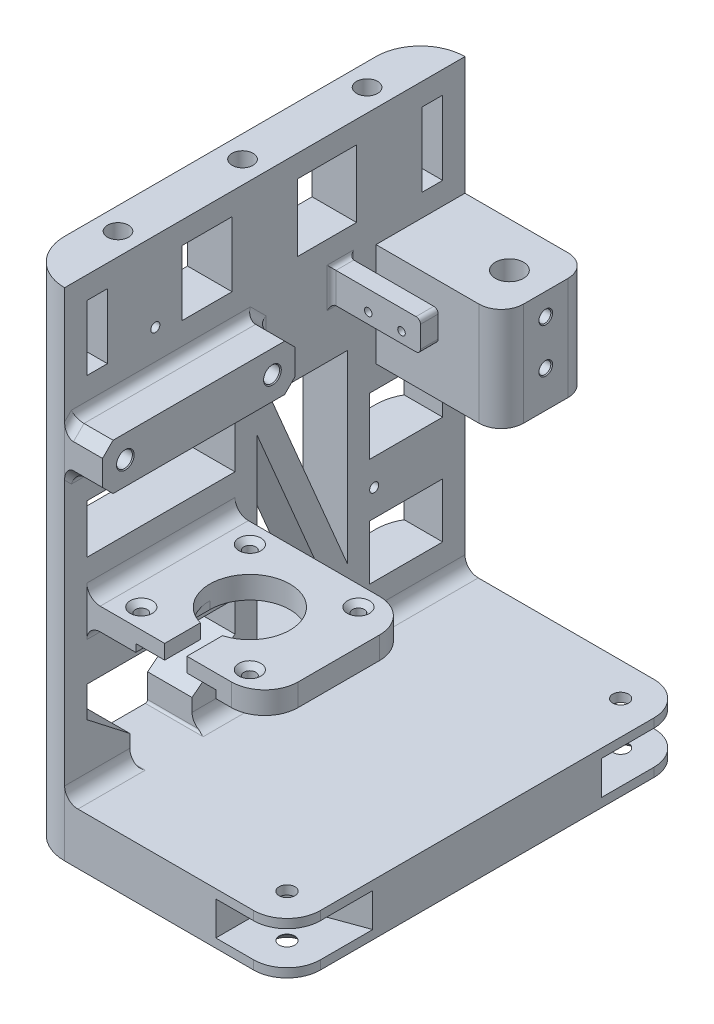
from build123d import *

# Parameters (mm, degrees)
BOSS_EXTRUDE1_DEPTH                             = 7.366
CUT_EXTRUDE1_DEPTH                              = 4.826
CSK_FOR_M4_FLAT_HEAD_MACHINE_SCREW1_D           = 4.5
CSK_FOR_M4_FLAT_HEAD_MACHINE_SCREW1_CSINK_D     = 9.4
CSK_FOR_M4_FLAT_HEAD_MACHINE_SCREW1_CSINK_ANGLE = 90
BOSS_EXTRUDE4_START                             = 127
BOSS_EXTRUDE4_DEPTH                             = 127
SKETCH31_R                                      = 3
CUT_EXTRUDE11_DEPTH                             = 25.4
FILLET3_R                                       = 3.81
SKETCH5_R                                       = 2.275
BOSS_EXTRUDE5_DEPTH                             = 10.840000164
CHAMFER1_SIZE                                   = 0.254
FILLET4_R                                       = 2.54
SKETCH9_W                                       = 42.3
SKETCH9_H                                       = 6.35
BOSS_EXTRUDE6_DEPTH                             = 50.8
CUT_EXTRUDE6_DEPTH                              = 106.448246074
CUT_EXTRUDE6_DEPTH_BACK                         = 6.35
CSK_FOR_M3_FLAT_HEAD_MACHINE_SCREW1_D           = 3.4
CSK_FOR_M3_FLAT_HEAD_MACHINE_SCREW1_DEPTH       = 6.35
CSK_FOR_M3_FLAT_HEAD_MACHINE_SCREW1_CSINK_D     = 6.3
CSK_FOR_M3_FLAT_HEAD_MACHINE_SCREW1_CSINK_ANGLE = 90
SKETCH13_W                                      = 22.86
SKETCH13_H                                      = 2.2
CUT_EXTRUDE7_DEPTH                              = 21.15
FILLET1_R                                       = 9.525
FILLET2_R                                       = 3.81
CUT_EXTRUDE8_DEPTH                              = 160.224980628
CUT_EXTRUDE8_DEPTH_BACK                         = 160.224980628
SKETCH20_W                                      = 25.4
SKETCH20_H                                      = 29.476999974
BOSS_EXTRUDE10_DEPTH                            = 35.76955
SKETCH21_R                                      = 4.01955
CUT_EXTRUDE9_DEPTH                              = 26.301999974
F_3_4_3_4_DIAMETER_HOLE4_D                      = 3.4
F_3_4_3_4_DIAMETER_HOLE4_DEPTH                  = 10.36955
F_3_4_3_4_DIAMETER_HOLE4_TIP                    = 1.021463052
CHAMFER2_SIZE                                   = 0.254
FILLET8_R                                       = 6.35
SKETCH26_W                                      = 5.08
SKETCH26_H                                      = 8.730000066
BOSS_EXTRUDE11_DEPTH                            = 25.4
SKETCH28_R                                      = 1.075
CUT_EXTRUDE10_DEPTH                             = 5.08
FILLET9_R                                       = 1.27
SKETCH34_R                                      = 1.3
CUT_EXTRUDE13_DEPTH                             = 12.7
CHAMFER3_SIZE                                   = 0.1905
SKETCH38_W                                      = 5.89
SKETCH38_H                                      = 21.09
SKETCH38_W_2                                    = 16.86
SKETCH38_H_2                                    = 19.202266412
SKETCH38_W_3                                    = 14.272
SKETCH38_H_3                                    = 18.55
SKETCH38_W_4                                    = 42.3
SKETCH38_H_4                                    = 13.97
SKETCH38_W_5                                    = 20.828
SKETCH38_H_5                                    = 16.362000012
SKETCH38_H_6                                    = 15.621000014
CUT_EXTRUDE14_DEPTH                             = 160.224980664


with BuildPart() as part:
    # Sketch1 → Boss-Extrude1 (new, symmetric)
    with BuildSketch(Plane(origin=(0, 0, 0), x_dir=(1, 0, 0), z_dir=(0, 1, 0))):
        with BuildLine():
            Line((-25.4, 57.15), (28.575, 57.15))
            ThreePointArc((28.575, 57.15), (35.310192091, 54.360192091), (38.1, 47.625))
            Line((38.1, 47.625), (38.1, -47.625))
            ThreePointArc((38.1, -47.625), (35.310192091, -54.360192091), (28.575, -57.15))
            Line((28.575, -57.15), (-25.4, -57.15))
            ThreePointArc((-25.4, -57.15), (-34.380256121, -53.430256121), (-38.1, -44.45))
            Line((-38.1, -44.45), (-38.1, 44.45))
            ThreePointArc((-38.1, 44.45), (-34.380256121, 53.430256121), (-25.4, 57.15))
        make_face()
    extrude(amount=BOSS_EXTRUDE1_DEPTH, both=True)

    # Sketch1<5> → Cut-Extrude1 (cut, symmetric)
    with BuildSketch(Plane(origin=(0, 0, 0), x_dir=(1, 0, 0), z_dir=(0, 1, 0))):
        with BuildLine():
            ThreePointArc((24.882892553, -37.481018159), (19.732253682, -41.43324237), (17.78, -47.625))
            Line((17.78, -47.625), (17.78, -57.15))
            Line((17.78, -57.15), (28.575, -57.15))
            ThreePointArc((28.575, -57.15), (35.310192091, -54.360192091), (38.1, -47.625))
            Line((38.1, -47.625), (38.1, -32.670384465))
            Line((38.1, -32.670384465), (24.882892553, -37.481018159))
        make_face()
        with BuildLine():
            Line((24.882892553, 37.481018159), (38.1, 32.670384465))
            Line((38.1, 32.670384465), (38.1, 47.625))
            ThreePointArc((38.1, 47.625), (35.310192091, 54.360192091), (28.575, 57.15))
            Line((28.575, 57.15), (17.78, 57.15))
            Line((17.78, 57.15), (17.78, 47.625))
            ThreePointArc((17.78, 47.625), (19.732253682, 41.43324237), (24.882892553, 37.481018159))
        make_face()
    extrude(amount=CUT_EXTRUDE1_DEPTH, both=True, mode=Mode.SUBTRACT)

    # CSK for M4 Flat Head Machine Screw1 (through all)
    with Locations(Plane.XZ.offset(7.366)):
        with Locations((28.575, 47.625), (28.575, -47.625)):
            CounterSinkHole(CSK_FOR_M4_FLAT_HEAD_MACHINE_SCREW1_D / 2, CSK_FOR_M4_FLAT_HEAD_MACHINE_SCREW1_CSINK_D / 2, counter_sink_angle=CSK_FOR_M4_FLAT_HEAD_MACHINE_SCREW1_CSINK_ANGLE)

    # Sketch4 → Boss-Extrude4 (add)
    with BuildSketch(Plane(origin=(0, 7.366, 0), x_dir=(1, 0, 0), z_dir=(0, 1, 0)).offset(BOSS_EXTRUDE4_START)):
        with BuildLine():
            Line((-38.1, 44.45), (-38.1, -44.45))
            ThreePointArc((-38.1, -44.45), (-34.380256121, -53.430256121), (-25.4, -57.15))
            Line((-25.4, -57.15), (-25.4, 57.15))
            ThreePointArc((-25.4, 57.15), (-34.380256121, 53.430256121), (-38.1, 44.45))
        make_face()
    extrude(amount=-BOSS_EXTRUDE4_DEPTH)

    # Sketch31 → Cut-Extrude11 (cut)
    with BuildSketch(Plane(origin=(0, 134.366, 0), x_dir=(1, 0, 0), z_dir=(0, 1, 0))):
        with Locations(Location((-31.75, 0, 0), (0, 0, 270))):
            Circle(SKETCH31_R)
        with Locations(Location((-31.75, 35.56, 0), (0, 0, 270))):
            Circle(SKETCH31_R)
        with Locations(Location((-31.75, -35.56, 0), (0, 0, 270))):
            Circle(SKETCH31_R)
    extrude(amount=-CUT_EXTRUDE11_DEPTH, mode=Mode.SUBTRACT)

    # Fillet3
    # the kernel refuses this fillet: 3.81 mm, written as the material it adds along each edge
    with BuildSketch(Plane(origin=(-25.4, 7.366, 57.15), x_dir=(1, 0, 0), z_dir=(0, 0, -1))) as fillet3_piece_1:
        with BuildLine():
            CenterArc((FILLET3_R, -FILLET3_R), FILLET3_R, 90, 90)
            Line((0, -FILLET3_R), (0, 0))
            Line((0, 0), (FILLET3_R, 0))
        make_face()
    extrude(amount=114.3)

    # Sketch5 → Boss-Extrude5 (add)
    with BuildSketch(Plane(origin=(-25.4, 0, 0), x_dir=(0, 0, -1), z_dir=(1, 0, 0))):
        Polygon((-5.15, 100.576), (-54.15, 100.576), (-57.15, 97.576), (-57.15, 90.376), (-54.15, 87.376), (-5.15, 87.376), (-2.15, 90.376), (-2.15, 97.576), align=None)
        with Locations((-8.65, 93.976)):
            Circle(SKETCH5_R, mode=Mode.SUBTRACT)
        with Locations((-50.65, 93.976)):
            Circle(SKETCH5_R, mode=Mode.SUBTRACT)
    extrude(amount=BOSS_EXTRUDE5_DEPTH)

    # Chamfer1
    chamfer1_edges = [part.edges().sort_by_distance(p)[0] for p in [
        (-14.559999836, 93.976, 10.925),
        (-14.559999836, 93.976, 52.925),
    ]]
    chamfer(chamfer1_edges, length=CHAMFER1_SIZE)

    # Fillet4
    fillet4_edges = [part.edges().sort_by_distance(p)[0] for p in [
        (-25.4, 99.076, 3.65),
        (-25.4, 100.576, 29.65),
        (-25.4, 99.076, 55.65),
        (-25.4, 88.876, 55.65),
        (-25.4, 87.376, 29.65),
        (-25.4, 88.876, 3.65),
        (-25.4, 93.976, 2.15),
    ]]
    fillet(fillet4_edges, radius=FILLET4_R)

    # Sketch9 → Boss-Extrude6 (add)
    with BuildSketch(Plane(origin=(-25.4, 0, 0), x_dir=(0, 0, -1), z_dir=(1, 0, 0))):
        with Locations((-29.65, 51.181)):
            Rectangle(SKETCH9_W, SKETCH9_H)
    extrude(amount=BOSS_EXTRUDE6_DEPTH)

    # Sketch12 → Cut-Extrude6 (cut, two sides: drawn at the far end of the back side and taken through both)
    with BuildSketch(Plane(origin=(0, 54.356, 0), x_dir=(1, 0, 0), z_dir=(0, 1, 0)).offset(-CUT_EXTRUDE6_DEPTH_BACK)):
        with BuildLine():
            Line((-3.175, -40.630176456), (-3.175, -50.8))
            Line((-3.175, -50.8), (3.175, -50.8))
            Line((3.175, -50.8), (3.175, -40.630176456))
            ThreePointArc((3.175, -40.630176456), (0, -18.22), (-3.175, -40.630176456))
        make_face()
    extrude(amount=CUT_EXTRUDE6_DEPTH + CUT_EXTRUDE6_DEPTH_BACK, mode=Mode.SUBTRACT)

    # CSK for M3 Flat Head Machine Screw1
    with Locations(Plane(origin=(0, 54.356, 0), x_dir=(1, 0, 0), z_dir=(0, 1, 0))):
        with Locations((15.5, -14.15), (-15.5, -45.15), (-15.5, -14.15), (15.5, -45.15)):
            CounterSinkHole(CSK_FOR_M3_FLAT_HEAD_MACHINE_SCREW1_D / 2, CSK_FOR_M3_FLAT_HEAD_MACHINE_SCREW1_CSINK_D / 2, depth=CSK_FOR_M3_FLAT_HEAD_MACHINE_SCREW1_DEPTH, counter_sink_angle=CSK_FOR_M3_FLAT_HEAD_MACHINE_SCREW1_CSINK_ANGLE)

    # Sketch13 → Cut-Extrude7 (cut)
    with BuildSketch(Plane(origin=(-25.4, 0, 50.8), x_dir=(-1, 0, 0), z_dir=(0, 0, -1))):
        with Locations((-25.4, 49.106)):
            Rectangle(SKETCH13_W, SKETCH13_H)
    extrude(amount=CUT_EXTRUDE7_DEPTH, mode=Mode.SUBTRACT)

    # Fillet1
    fillet1_edges = [part.edges().sort_by_distance(p)[0] for p in [
        (25.4, 51.181, 50.8),
        (25.4, 51.181, 8.5),
    ]]
    fillet(fillet1_edges, radius=FILLET1_R)

    # Fillet2
    fillet2_edges = [part.edges().sort_by_distance(p)[0] for p in [
        (-25.4, 48.006, 29.65),
        (-25.4, 54.356, 29.65),
    ]]
    fillet(fillet2_edges, radius=FILLET2_R)

    # Sketch14 → Cut-Extrude8 (cut, two sides: drawn at the far end of the back side and taken through both)
    with BuildSketch(Plane(origin=(-25.4, 0, 0), x_dir=(0, 0, -1), z_dir=(1, 0, 0)).offset(-CUT_EXTRUDE8_DEPTH_BACK)):
        with BuildLine():
            Line((-37.905, 7.366), (-21.395, 7.366))
            ThreePointArc((-21.395, 7.366), (-20.945987194, 7.551987194), (-20.76, 8.001))
            Line((-20.76, 8.001), (-20.76, 17.399))
            ThreePointArc((-20.76, 17.399), (-20.945987194, 17.848012806), (-21.395, 18.034))
            Line((-21.395, 18.034), (-37.905, 18.034))
            ThreePointArc((-37.905, 18.034), (-38.354012806, 17.848012806), (-38.54, 17.399))
            Line((-38.54, 17.399), (-38.54, 8.001))
            ThreePointArc((-38.54, 8.001), (-38.354012806, 7.551987194), (-37.905, 7.366))
        make_face()
    extrude(amount=CUT_EXTRUDE8_DEPTH + CUT_EXTRUDE8_DEPTH_BACK, mode=Mode.SUBTRACT)

    # Sketch20 → Boss-Extrude10 (add)
    with BuildSketch(Plane(origin=(-25.4, 0, 0), x_dir=(0, 0, -1), z_dir=(1, 0, 0))):
        with Locations((44.45, 85.837500013)):
            Rectangle(SKETCH20_W, SKETCH20_H)
    extrude(amount=BOSS_EXTRUDE10_DEPTH)

    # Sketch21 → Cut-Extrude9 (cut)
    with BuildSketch(Plane(origin=(0, 100.576, 0), x_dir=(1, 0, 0), z_dir=(0, 1, 0))):
        with Locations(Location((0, 44.45, 0), (0, 0, 270))):
            Circle(SKETCH21_R)
    extrude(amount=-CUT_EXTRUDE9_DEPTH, mode=Mode.SUBTRACT)

    # Ø3.4 (3.4) Diameter Hole4
    with Locations(Plane(origin=(10.36955, 0, 0), x_dir=(0, 0, -1), z_dir=(1, 0, 0))):
        with Locations((44.45, 94.226), (44.45, 81.526)):
            Hole(F_3_4_3_4_DIAMETER_HOLE4_D / 2, depth=F_3_4_3_4_DIAMETER_HOLE4_DEPTH)
            with Locations((0, 0, -(F_3_4_3_4_DIAMETER_HOLE4_DEPTH + F_3_4_3_4_DIAMETER_HOLE4_TIP / 2))):  # 118° drill point
                Cone(0, F_3_4_3_4_DIAMETER_HOLE4_D / 2, F_3_4_3_4_DIAMETER_HOLE4_TIP, mode=Mode.SUBTRACT)

    # Chamfer2
    chamfer2_edges = [part.edges().sort_by_distance(p)[0] for p in [
        (10.36955, 81.526, -46.15),
        (10.36955, 94.226, -46.15),
    ]]
    chamfer(chamfer2_edges, length=CHAMFER2_SIZE)

    # Fillet8
    fillet8_edges = [part.edges().sort_by_distance(p)[0] for p in [
        (10.36955, 85.837500013, -57.15),
        (10.36955, 85.837500013, -31.75),
    ]]
    fillet(fillet8_edges, radius=FILLET8_R)

    # Sketch26 → Boss-Extrude11 (add)
    with BuildSketch(Plane(origin=(-25.4, 0, 0), x_dir=(0, 0, -1), z_dir=(1, 0, 0))):
        with Locations((21.59, 96.828733555)):
            Rectangle(SKETCH26_W, SKETCH26_H)
    extrude(amount=BOSS_EXTRUDE11_DEPTH)

    # Sketch28 → Cut-Extrude10 (cut)
    with BuildSketch(Plane.XY.offset(-19.05)):
        with Locations((-14.909999898, 95.488733568)):
            Circle(SKETCH28_R)
        with Locations((-5.409993498, 95.488733568)):
            Circle(SKETCH28_R)
    extrude(amount=-CUT_EXTRUDE10_DEPTH, mode=Mode.SUBTRACT)

    # Fillet9
    fillet9_edges = [part.edges().sort_by_distance(p)[0] for p in [
        (-25.4, 96.828733555, -19.05),
        (-25.4, 92.463733522, -21.59),
        (-25.4, 96.828733555, -24.13),
        (-25.4, 101.193733588, -21.59),
        (0, 92.463733522, -21.59),
        (0, 101.193733588, -21.59),
    ]]
    fillet(fillet9_edges, radius=FILLET9_R)

    # Sketch34 → Cut-Extrude13 (cut)
    with BuildSketch(Plane.ZY.offset(38.1)):
        with Locations((-31.242, 40.767000014)):
            Circle(SKETCH34_R)
        with Locations((31.242, 40.767000014)):
            Circle(SKETCH34_R)
        with Locations((31.242, 111.633000014)):
            Circle(SKETCH34_R)
    extrude(amount=-CUT_EXTRUDE13_DEPTH, mode=Mode.SUBTRACT)

    # Chamfer3
    chamfer3_edges = [part.edges().sort_by_distance(p)[0] for p in [
        (-38.1, 40.767000014, -32.542),
        (-38.1, 111.633000014, 29.942),
        (-38.1, 40.767000014, 29.942),
    ]]
    chamfer(chamfer3_edges, length=CHAMFER3_SIZE)

    # Sketch38 → Cut-Extrude14 (cut, through all)
    with BuildSketch(Plane(origin=(-25.4, 0, 0), x_dir=(0, 0, -1), z_dir=(1, 0, 0))):
        with Locations((47.855, 117.471)):
            Rectangle(SKETCH38_W, SKETCH38_H)
        with Locations((17.78, 118.414866794)):
            Rectangle(SKETCH38_W_2, SKETCH38_H_2)
        with Locations((-16.486, 118.741)):
            Rectangle(SKETCH38_W_3, SKETCH38_H_3)
        with Locations((-29.65, 71.501)):
            Rectangle(SKETCH38_W_4, SKETCH38_H_4)
        Polygon((1.297081652, 78.486), (23.622, 78.486), (23.622, 25.67958131), align=None)
        Polygon((-2.15, 70.33241869), (-2.15, 17.526), (20.174918348, 17.526), align=None)
        with Locations((40.386, 56.56800002)):
            Rectangle(SKETCH38_W_5, SKETCH38_H_5)
        with Locations((40.386, 25.336500007)):
            Rectangle(SKETCH38_W_5, SKETCH38_H_6)
        Polygon((-38.54, 14.859), (-50.8, 24.384), (-50.8, 33.147000014), (-8.5, 33.147000014), (-8.5, 24.384), (-20.76, 14.859), align=None)
        with Locations((-47.855, 118.741)):
            Rectangle(SKETCH38_W, SKETCH38_H_3)
    extrude(amount=-CUT_EXTRUDE14_DEPTH, mode=Mode.SUBTRACT)


solid = part.part
